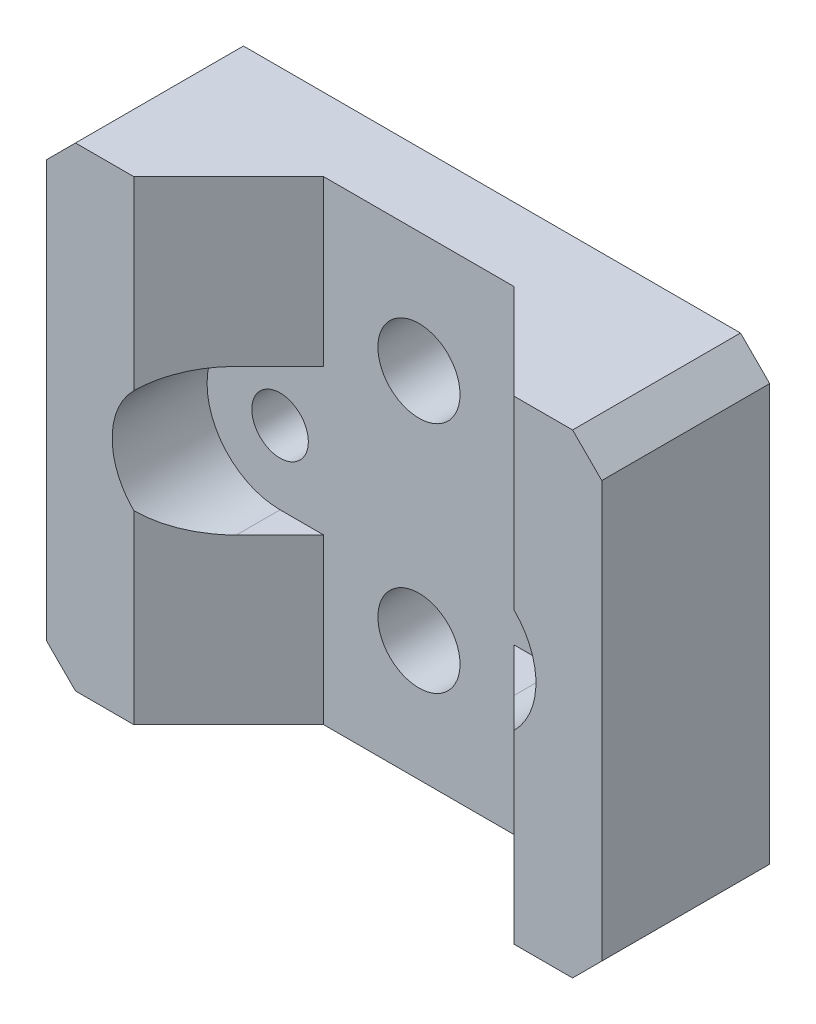
from build123d import *

# Parameters (mm, degrees)
SKETCH1_W                 = 48.308864232
SKETCH1_H                 = 41.275
BOSS_EXTRUDE1_DEPTH       = 6.35
F_8_CLEARANCE_HOLE1_D     = 4.9149
F_1_4_CLEARANCE_HOLE1_D   = 7.14248
SKETCH9_W                 = 6.35
SKETCH9_H                 = 41.275
EXTRUDE_THIN1_DEPTH       = 8.255
CHAMFER2_SIZE             = 9.525
CUT_EXTRUDE1_DEPTH        = 156.127382276
CHAMFER1_SIZE             = 2.54
HOLE1_AT_2_COUNT          = 2
HOLE1_AT_2_PITCH          = 9.3599
F_2_CLEARANCE_HOLE1_D     = 2.7051
F_2_CLEARANCE_HOLE1_DEPTH = 3.175


with BuildPart() as part:
    # Sketch1 → Boss-Extrude1 (new body)
    with BuildSketch(Plane.XY):
        with Locations((-124.004465969, -24.5875)):
            Rectangle(SKETCH1_W, SKETCH1_H)
    extrude(amount=BOSS_EXTRUDE1_DEPTH)

    # #8 Clearance Hole1 (through all)
    with Locations(Plane.XY.offset(6.35)):
        with Locations((-111.927249911, -24.5875), (-136.081682027, -24.5875)):
            Hole(F_8_CLEARANCE_HOLE1_D / 2)

    # 1/4 Clearance Hole1 (through all)
    with Locations(Plane.XY.offset(6.35)):
        with Locations((-124.004465969, -14.4275), (-124.004465969, -34.7475)):
            Hole(F_1_4_CLEARANCE_HOLE1_D / 2)

    # Sketch9 → Extrude-Thin1 (add)
    with BuildSketch(Plane.XY.offset(6.35)):
        with Locations((-103.025033853, -24.5875)):
            Rectangle(SKETCH9_W, SKETCH9_H)
        with Locations((-144.983898085, -24.5875)):
            Rectangle(SKETCH9_W, SKETCH9_H)
    extrude(amount=EXTRUDE_THIN1_DEPTH)

    # Chamfer2
    # the kernel refuses this chamfer: 9.525 mm, written as the material it adds along each edge
    with BuildSketch(Plane(origin=(-106.200033853, -3.95, 6.35), x_dir=(0.0274958766105871, 0, 0.9996219169112966), z_dir=(0, -1, 0))) as chamfer2_piece_1_section:
        Polygon((CHAMFER2_SIZE * 0.999621916911, CHAMFER2_SIZE * 0.0274958766106), (-CHAMFER2_SIZE * 0.0274958766106, CHAMFER2_SIZE * 0.999621916911), (0, 0), align=None)
    chamfer2_piece_1 = extrude(amount=41.275, mode=Mode.PRIVATE)
    chamfer2_piece_1 = chamfer2_piece_1 - Plane(origin=(-111.927249911, -24.5875, 9.368765613), x_dir=(-1, 0, 0), z_dir=(0, 0, -1)) * Cylinder(2.45745, 121, mode=Mode.PRIVATE)
    chamfer2_piece_1 = split(chamfer2_piece_1, bisect_by=Plane(origin=(-109.341812124, -24.58749874, 14.605), z_dir=(0, 0, -1)), keep=Keep.TOP, mode=Mode.PRIVATE)
    add(chamfer2_piece_1)
    with BuildSketch(Plane(origin=(-141.808898085, -45.225, 6.35), x_dir=(0.9996219169112968, 0, -0.027495876610586386), z_dir=(0, 1, 0))) as chamfer2_piece_2_section:
        Polygon((CHAMFER2_SIZE * 0.999621916911, -CHAMFER2_SIZE * 0.0274958766106), (-CHAMFER2_SIZE * 0.0274958766106, -CHAMFER2_SIZE * 0.999621916911), (0, 0), align=None)
    chamfer2_piece_2 = extrude(amount=41.275, mode=Mode.PRIVATE)
    chamfer2_piece_2 = chamfer2_piece_2 - Plane(origin=(-136.081682027, -24.5875, 9.368765819), x_dir=(-1, 0, 0), z_dir=(0, 0, -1)) * Cylinder(2.45745, 121, mode=Mode.PRIVATE)
    chamfer2_piece_2 = split(chamfer2_piece_2, bisect_by=Plane(origin=(-138.667118685, -24.587501904, 14.605), z_dir=(0, 0, -1)), keep=Keep.TOP, mode=Mode.PRIVATE)
    add(chamfer2_piece_2)

    # Sketch10 → Cut-Extrude1 (cut, through all)
    with BuildSketch(Plane.XY.offset(6.35)):
        with BuildLine():
            Line((-136.081682027, -18.2375), (-111.927249911, -18.2375))
            ThreePointArc((-111.927249911, -18.2375), (-105.577249911, -24.5875), (-111.927249911, -30.9375))
            Line((-111.927249911, -30.9375), (-136.081682027, -30.9375))
            ThreePointArc((-136.081682027, -30.9375), (-142.431682027, -24.5875), (-136.081682027, -18.2375))
        make_face()
    extrude(amount=CUT_EXTRUDE1_DEPTH, mode=Mode.SUBTRACT)

    # Chamfer1
    chamfer1_edges = [part.edges().sort_by_distance(p)[0] for p in [
        (-99.850033853, -45.225, 7.3025),
        (-148.158898085, -45.225, 7.3025),
        (-148.158898085, -3.95, 7.3025),
        (-99.850033853, -3.95, 7.3025),
    ]]
    chamfer(chamfer1_edges, length=CHAMFER1_SIZE)

    # Sketch12 → Hole1 (revolve, cut)
    with BuildSketch(Plane(origin=(-148.158898085, -26.4544, 7.4422), x_dir=(0, 0, 1), z_dir=(0, 1, 0))):
        Polygon((0, 0), (0, 2.921), (1.4986, 2.921), (1.6383, 0), align=None)
    hole1 = revolve(axis=Axis((-38.158898085, -26.4544, 7.4422), (-1, 0, 0)), mode=Mode.SUBTRACT)

    # Hole1 at 2: Hole1 ×2
    with Locations(*[(0, i * HOLE1_AT_2_PITCH, 0) for i in range(1, HOLE1_AT_2_COUNT)]):
        add(hole1, mode=Mode.SUBTRACT)

    # #2 Clearance Hole1
    with Locations(Plane.ZY.offset(148.158898085)):
        with Locations((7.4422, -17.0945), (7.4422, -26.4544)):
            Hole(F_2_CLEARANCE_HOLE1_D / 2, depth=F_2_CLEARANCE_HOLE1_DEPTH)


solid = part.part
